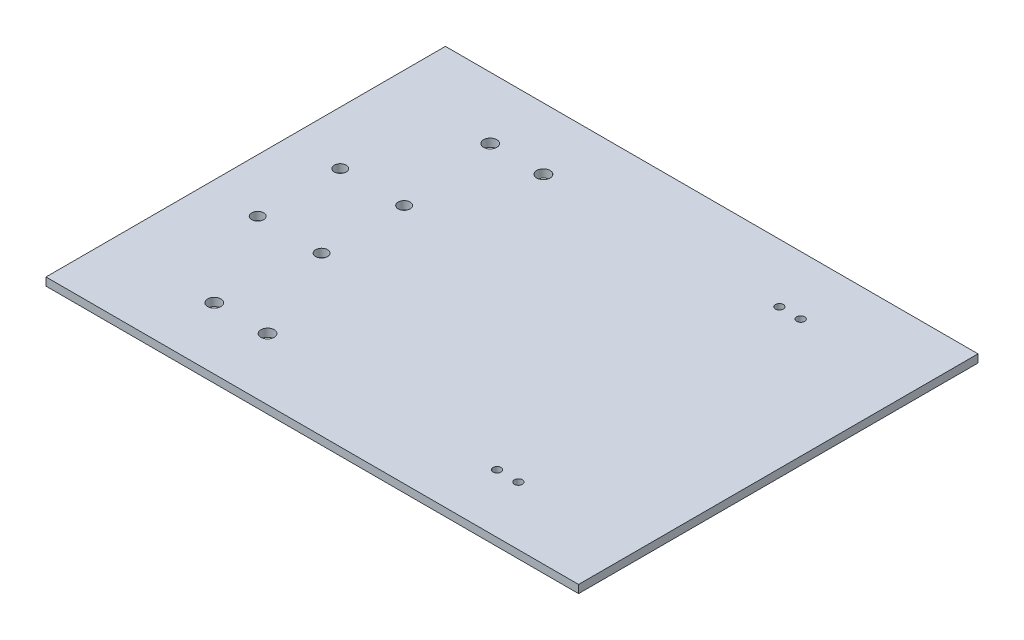
from build123d import *

# Parameters (mm, degrees)
SKETCH2_W           = 200
SKETCH2_H           = 150
BOSS_EXTRUDE1_DEPTH = 3
SKETCH3_R           = 1.5
SKETCH3_R_2         = 2.25
SKETCH3_R_3         = 2.5
CUT_EXTRUDE1_DEPTH  = 10


with BuildPart() as part:
    # Sketch2 → Boss-Extrude1 (new body)
    with BuildSketch(Plane(origin=(0, 0, 0), x_dir=(1, 0, 0), z_dir=(0, 1, 0))):
        with Locations((100, 75)):
            Rectangle(SKETCH2_W, SKETCH2_H)
    extrude(amount=BOSS_EXTRUDE1_DEPTH)

    # Sketch3 → Cut-Extrude1 (cut)
    with BuildSketch(Plane(origin=(0, 3, 0), x_dir=(1, 0, 0), z_dir=(0, 1, 0))):
        with Locations((155.4, 128)):
            Circle(SKETCH3_R)
        with Locations((147.4, 128)):
            Circle(SKETCH3_R)
        with Locations((147.4, 22)):
            Circle(SKETCH3_R)
        with Locations((155.4, 22)):
            Circle(SKETCH3_R)
        with Locations((20, 90.5)):
            Circle(SKETCH3_R_2)
        with Locations((44, 90.5)):
            Circle(SKETCH3_R_2)
        with Locations((44, 59.5)):
            Circle(SKETCH3_R_2)
        with Locations((20, 59.5)):
            Circle(SKETCH3_R_2)
        with Locations((40, 23.2)):
            Circle(SKETCH3_R_3)
        with Locations((60, 23.2)):
            Circle(SKETCH3_R_3)
        with Locations((60, 126.8)):
            Circle(SKETCH3_R_3)
        with Locations((40, 126.8)):
            Circle(SKETCH3_R_3)
    extrude(amount=-CUT_EXTRUDE1_DEPTH, mode=Mode.SUBTRACT)


solid = part.part
